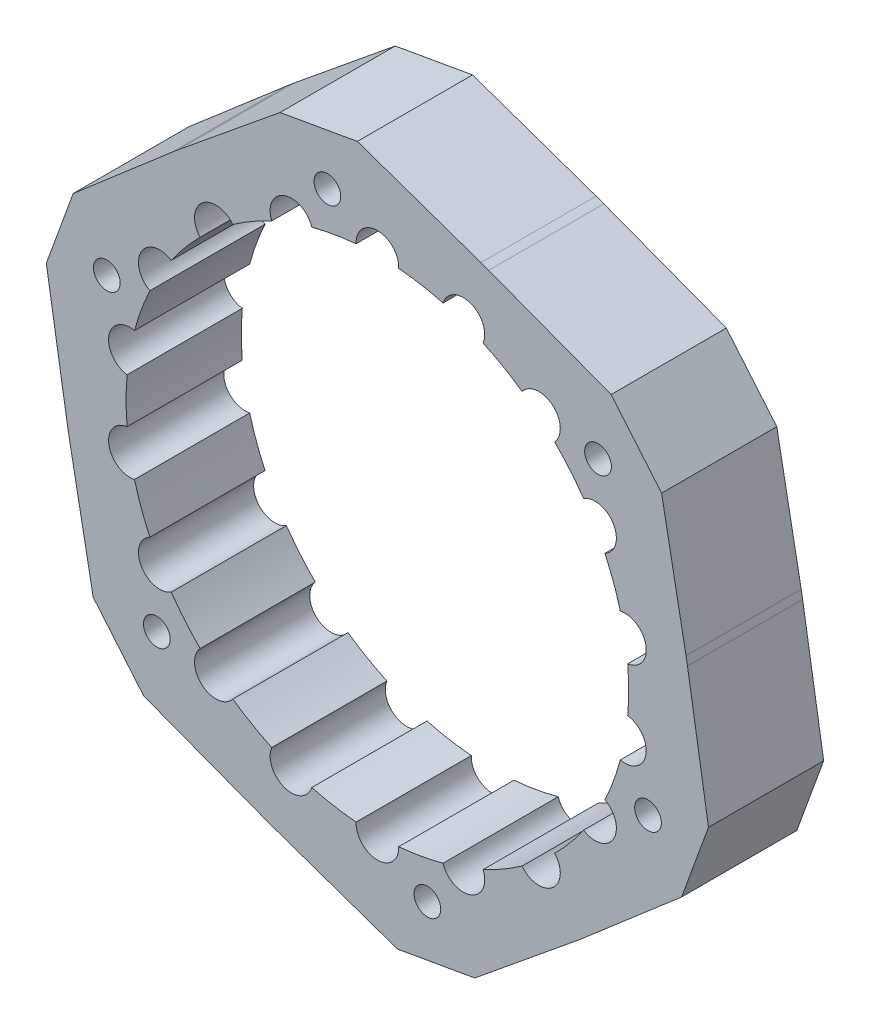
from build123d import *

# Parameters (mm, degrees)
SKETCH1_R           = 60
BOSS_EXTRUDE1_DEPTH = 22
SKETCH2_R           = 2.55
CUT_EXTRUDE2_DEPTH  = 88.658428003
BOSS_EXTRUDE2_START = -22
BOSS_EXTRUDE2_DEPTH = 22


with BuildPart() as part:
    # Sketch1 → Boss-Extrude1 (new body)
    with BuildSketch(Plane.XY):
        Circle(SKETCH1_R)
        with BuildLine():
            ThreePointArc((-12.5320098, 46.335178109), (-17.810698964, 48.934493227), (-20.183601913, 43.550226335))
            ThreePointArc((-20.183601913, 43.550226335), (-24, 41.569219382), (-27.623801391, 39.254625164))
            ThreePointArc((-27.623801391, 39.254625164), (-33.473164774, 39.891764375), (-33.861436431, 34.020627902))
            ThreePointArc((-33.861436431, 34.020627902), (-36.77013327, 30.853805265), (-39.383754849, 27.439385087))
            ThreePointArc((-39.383754849, 27.439385087), (-45.098272902, 26.0375), (-43.455081974, 20.387639652))
            ThreePointArc((-43.455081974, 20.387639652), (-45.105245798, 16.41696688), (-46.393446231, 12.314550207))
            ThreePointArc((-46.393446231, 12.314550207), (-51.283863738, 9.042728852), (-47.807403303, 4.295601171))
            ThreePointArc((-47.807403303, 4.295601171), (-48, 0), (-47.807403303, -4.295601171))
            ThreePointArc((-47.807403303, -4.295601171), (-51.283863738, -9.042728852), (-46.393446231, -12.314550207))
            ThreePointArc((-46.393446231, -12.314550207), (-45.105245798, -16.41696688), (-43.455081974, -20.387639652))
            ThreePointArc((-43.455081974, -20.387639652), (-45.098272902, -26.0375), (-39.383754849, -27.439385087))
            ThreePointArc((-39.383754849, -27.439385087), (-36.77013327, -30.853805265), (-33.861436431, -34.020627902))
            ThreePointArc((-33.861436431, -34.020627902), (-33.473164774, -39.891764375), (-27.623801391, -39.254625164))
            ThreePointArc((-27.623801391, -39.254625164), (-24, -41.569219382), (-20.183601913, -43.550226335))
            ThreePointArc((-20.183601913, -43.550226335), (-17.810698964, -48.934493227), (-12.5320098, -46.335178109))
            ThreePointArc((-12.5320098, -46.335178109), (-8.335112528, -47.270772145), (-4.071327125, -47.82702474))
            ThreePointArc((-4.071327125, -47.82702474), (0, -52.075), (4.071327125, -47.82702474))
            ThreePointArc((4.071327125, -47.82702474), (8.335112528, -47.270772145), (12.5320098, -46.335178109))
            ThreePointArc((12.5320098, -46.335178109), (17.810698964, -48.934493227), (20.183601913, -43.550226335))
            ThreePointArc((20.183601913, -43.550226335), (24, -41.569219382), (27.623801391, -39.254625164))
            ThreePointArc((27.623801391, -39.254625164), (33.473164774, -39.891764375), (33.861436431, -34.020627902))
            ThreePointArc((33.861436431, -34.020627902), (36.77013327, -30.853805265), (39.383754849, -27.439385087))
            ThreePointArc((39.383754849, -27.439385087), (45.098272902, -26.0375), (43.455081974, -20.387639652))
            ThreePointArc((43.455081974, -20.387639652), (45.105245798, -16.41696688), (46.393446231, -12.314550207))
            ThreePointArc((46.393446231, -12.314550207), (51.283863738, -9.042728852), (47.807403303, -4.295601171))
            ThreePointArc((47.807403303, -4.295601171), (48, 0), (47.807403303, 4.295601171))
            ThreePointArc((47.807403303, 4.295601171), (51.283863738, 9.042728852), (46.393446231, 12.314550207))
            ThreePointArc((46.393446231, 12.314550207), (45.105245798, 16.41696688), (43.455081974, 20.387639652))
            ThreePointArc((43.455081974, 20.387639652), (45.098272902, 26.0375), (39.383754849, 27.439385087))
            ThreePointArc((39.383754849, 27.439385087), (36.77013327, 30.853805265), (33.861436431, 34.020627902))
            ThreePointArc((33.861436431, 34.020627902), (33.473164774, 39.891764375), (27.623801391, 39.254625164))
            ThreePointArc((27.623801391, 39.254625164), (24, 41.569219382), (20.183601913, 43.550226335))
            ThreePointArc((20.183601913, 43.550226335), (17.810698964, 48.934493227), (12.5320098, 46.335178109))
            ThreePointArc((12.5320098, 46.335178109), (8.335112528, 47.270772145), (4.071327125, 47.82702474))
            ThreePointArc((4.071327125, 47.82702474), (0, 52.075), (-4.071327125, 47.82702474))
            ThreePointArc((-4.071327125, 47.82702474), (-8.335112528, 47.270772145), (-12.5320098, 46.335178109))
        make_face(mode=Mode.SUBTRACT)
    extrude(amount=BOSS_EXTRUDE1_DEPTH)

    # Sketch2 → Cut-Extrude2 (cut, through all)
    with BuildSketch(Plane.XY.offset(22)):
        with Locations((-9.550649772, 54.164426416)):
            Circle(SKETCH2_R)
        with Locations((42.132444372, 35.353318533)):
            Circle(SKETCH2_R)
        with Locations((51.683094143, -18.811107883)):
            Circle(SKETCH2_R)
        with Locations((9.550649772, -54.164426416)):
            Circle(SKETCH2_R)
        with Locations((-42.132444372, -35.353318533)):
            Circle(SKETCH2_R)
        with Locations((-51.683094143, 18.811107883)):
            Circle(SKETCH2_R)
    extrude(amount=-CUT_EXTRUDE2_DEPTH, mode=Mode.SUBTRACT)

    # Sketch3 → Boss-Extrude2 (add)
    with BuildSketch(Plane.XY.offset(22).offset(BOSS_EXTRUDE2_START)):
        with BuildLine():
            Line((-37.958811886, 46.46642444), (-18.597801703, 62.282596059))
            Line((-18.597801703, 62.282596059), (-3.825685408, 64.887318724))
            Line((-3.825685408, 64.887318724), (19.777162276, 56.646834442))
            ThreePointArc((19.777162276, 56.646834442), (-10.41889066, 59.088465181), (-37.958811886, 46.46642444))
        make_face()
        with BuildLine():
            Line((54.281223694, 35.756800112), (58.946178809, 11.195892275))
            ThreePointArc((58.946178809, 11.195892275), (45.962666587, 38.567256581), (21.261698045, 56.106507611))
            Line((21.261698045, 56.106507611), (44.639409549, 47.247466759))
            Line((44.639409549, 47.247466759), (54.281223694, 35.756800112))
        make_face()
        with BuildLine():
            Line((58.106909102, -29.130518612), (39.169016532, -45.450942167))
            ThreePointArc((39.169016532, -45.450942167), (56.381557247, -20.5212086), (59.220509931, 9.640083171))
            Line((59.220509931, 9.640083171), (63.237211252, -15.0351293))
            Line((63.237211252, -15.0351293), (58.106909102, -29.130518612))
        make_face()
        with BuildLine():
            Line((3.825685408, -64.887318724), (-19.777162276, -56.646834442))
            ThreePointArc((-19.777162276, -56.646834442), (10.41889066, -59.088465181), (37.958811886, -46.46642444))
            Line((37.958811886, -46.46642444), (18.597801703, -62.282596059))
            Line((18.597801703, -62.282596059), (3.825685408, -64.887318724))
        make_face()
        with BuildLine():
            Line((-54.281223694, -35.756800112), (-58.946178809, -11.195892275))
            ThreePointArc((-58.946178809, -11.195892275), (-45.962666587, -38.567256581), (-21.261698045, -56.106507611))
            Line((-21.261698045, -56.106507611), (-44.639409549, -47.247466759))
            Line((-44.639409549, -47.247466759), (-54.281223694, -35.756800112))
        make_face()
        with BuildLine():
            Line((-58.106909102, 29.130518612), (-39.169016532, 45.450942167))
            ThreePointArc((-39.169016532, 45.450942167), (-56.381557247, 20.5212086), (-59.220509931, -9.640083171))
            Line((-59.220509931, -9.640083171), (-63.237211252, 15.0351293))
            Line((-63.237211252, 15.0351293), (-58.106909102, 29.130518612))
        make_face()
    extrude(amount=BOSS_EXTRUDE2_DEPTH)


solid = part.part
